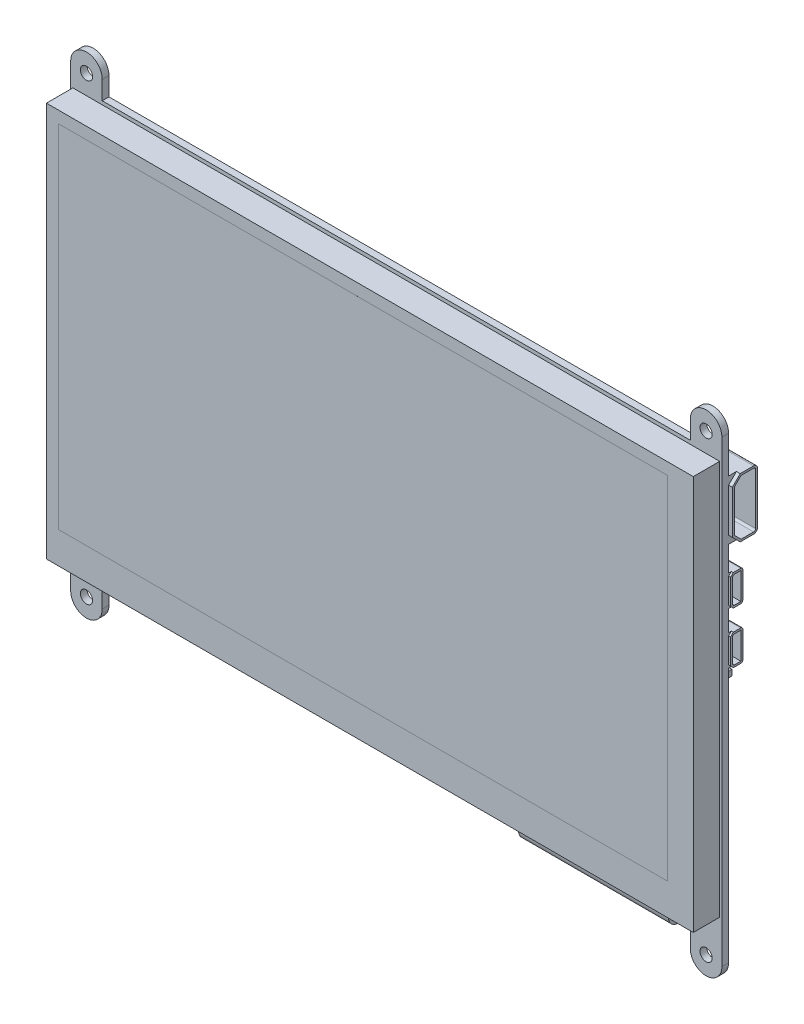
from build123d import *

# Parameters (mm, degrees)
SKICA1_W                             = 164
SKICA1_H                             = 100.1
P_IDAT_VYSUNUT_M1_DEPTH              = 6.7
SKICA1_3_W                           = 165.1
SKICA1_3_H                           = 106.9
P_IDAT_VYSUNUT_M2_DEPTH              = 1.7
SKICA2_R                             = 1.55
P_IDAT_VYSUNUT_M3_DEPTH              = 1.7
SKICA3_W                             = 154.5
SKICA3_H                             = 89.1
ODEBRAT_VYSUNUT_M1_DEPTH             = 1.5
SKICA3_2_W                           = 154.5
SKICA3_2_H                           = 89.1
P_IDAT_VYSUNUT_M4_DEPTH              = 1.5
SKICA4_W                             = 38
SKICA4_H                             = 2.75
P_IDAT_VYSUNUT_M5_DEPTH              = 6.3
ZAOBLIT1_R                           = 2.5
SKICA5_W                             = 28.5
SKICA5_H                             = 0.9
P_IDAT_VYSUNUT_M6_DEPTH              = 4.3
ZAOBLIT2_R                           = 3
SKICA6_W                             = 34
SKICA6_H                             = 22.4
P_IDAT_VYSUNUT_M7_DEPTH              = 2.4
SKICA6_3_W                           = 8.3
SKICA6_3_H                           = 16.4
P_IDAT_VYSUNUT_M8_DEPTH              = 1.8
SKICA6_4_W                           = 4.4
SKICA6_4_H                           = 11
P_IDAT_VYSUNUT_M9_DEPTH              = 1
SKICA6_5_W                           = 2.9
SKICA6_5_H                           = 17.2
SKICA6_5_W_2                         = 4.1
SKICA6_5_H_2                         = 4.3
P_IDAT_VYSUNUT_M10_DEPTH             = 1
SKICA6_6_W                           = 19.9
SKICA6_6_H                           = 13.8
P_IDAT_VYSUNUT_M11_DEPTH             = 1.45
SKICA6_7_W                           = 23.7
SKICA6_7_H                           = 12.8
SKICA6_7_W_2                         = 18.8
SKICA6_7_H_2                         = 17.8
P_IDAT_VYSUNUT_M12_DEPTH             = 0.8
ZKOSEN_1_SIZE                        = 0.8
SKICA7_W                             = 6.8
SKICA7_H                             = 6.8
P_IDAT_VYSUNUT_M13_DEPTH             = 1.5
SKICA7_3_W                           = 5.7
SKICA7_3_H                           = 10
SKICA7_3_W_2                         = 10
SKICA7_3_H_2                         = 5.7
P_IDAT_VYSUNUT_M14_DEPTH             = 0.8
P_IDAT_VYSUNUT_M15_DEPTH             = 0.7
P_IDAT_VYSUNUT_M16_DEPTH             = 4.2
SKICA7_6_W                           = 2.3
SKICA7_6_H                           = 7.8
SKICA7_6_W_2                         = 4.5
SKICA7_6_H_2                         = 2.5
SKICA7_6_W_3                         = 1.65
SKICA7_6_H_3                         = 5.9
SKICA7_6_W_4                         = 2
SKICA7_6_H_4                         = 1.3
P_IDAT_VYSUNUT_M17_DEPTH             = 0.8
ZKOSEN_2_SIZE                        = 0.8
SKICA8_W                             = 37.7
SKICA8_H                             = 5
ODEBRAT_VYSUNUT_M2_DEPTH             = 1.6
SKICA9_W                             = 25.6
SKICA9_H                             = 4
P_IDAT_VYSUNUT_M18_DEPTH             = 2
SKICA9_3_W                           = 2.35
SKICA9_3_H                           = 5
P_IDAT_VYSUNUT_M19_DEPTH             = 2.1
ZKOSEN_3_SIZE                        = 0.5
P_IDAT_VYSUNUT_M20_DEPTH             = 1.25
P_IDAT_VYSUNUT_M20_DEPTH_BACK        = 1.6
SKICA10_W                            = 25.6
SKICA10_H                            = 21
SKICA10_W_2                          = 2.9
SKICA10_H_2                          = 4.5
ZAOBLIT3_R                           = 3
SKICA11_W                            = 6.4
SKICA11_H                            = 3.4
P_IDAT_VYSUNUT_M21_DEPTH             = 1.9
SKICA11_3_W                          = 0.75
SKICA11_3_H                          = 2.1
SKICA11_3_W_2                        = 3
SKICA11_3_H_2                        = 2.5
P_IDAT_VYSUNUT_M23_DEPTH             = 0.8
ZKOSEN_4_SIZE                        = 0.8
SKICA12_W                            = 2.5
SKICA12_H                            = 7.5
SKICA12_H_2                          = 3.2
SKICA12_H_3                          = 4.5
SKICA12_H_4                          = 1
SKICA12_W_2                          = 11
SKICA12_H_5                          = 2.5
SKICA12_W_3                          = 2.8
SKICA12_W_4                          = 1
P_IDAT_VYSUNUT_M24_DEPTH             = 1.6
SKICA14_W                            = 2.4
SKICA14_H                            = 2.7
SKICA14_W_2                          = 4.4
P_IDAT_VYSUNUT_M25_DEPTH             = 0.8
P_IDAT_VYSUNUT_M26_DEPTH             = 1.6
SKICA15_W                            = 7.9
SKICA15_H                            = 2.8
SKICA15_W_2                          = 6.4
P_IDAT_VYSUNUT_M27_DEPTH             = 1.2
SKICA17_W                            = 5.2
SKICA17_H                            = 1.9
ODEBRAT_VYSUNUT_M3_DEPTH             = 1.6
SKICA18_W                            = 7.4
SKICA18_H                            = 5.5
P_IDAT_VYSUNUT_M28_DEPTH             = 2.4
SKICA18_3_W                          = 3.5
SKICA18_3_H                          = 13.3
P_IDAT_VYSUNUT_M29_DEPTH             = 0.5
P_IDAT_VYSUNUT_M29_DIRECTION_2_REACH = 107.189
ZAOBLIT4_R                           = 2
SKICA19_W                            = 11.7
SKICA19_H                            = 15
P_IDAT_VYSUNUT_M30_DEPTH             = 6.4
ZAOBLIT5_R                           = 1
ZKOSEN_5_SIZE                        = 2
ODEBRAT_VYSUNUT_M4_DEPTH             = 6.7
P_IDAT_START                         = -2.5
SKICA21_W                            = 1
SKICA21_H                            = 10
P_IDAT_VYSUNUT_M31_DEPTH             = 6.7
SKICA22_W                            = 5.8
SKICA22_H                            = 7.8
P_IDAT_VYSUNUT_M32_DEPTH             = 3.1
SKICA23_W                            = 2.1
SKICA23_H                            = 6.8
ODEBRAT_VYSUNUT_M5_DEPTH             = 3.9
ZAOBLIT6_R                           = 0.5
ZAOBLIT7_R                           = 0.5
ZKOSEN_6_SIZE                        = 0.7
SKICA24_W                            = 3.5
SKICA24_H                            = 9
P_IDAT_VYSUNUT_M33_DEPTH             = 3.25
SKICA24_3_W                          = 7.5
SKICA24_3_H                          = 1
P_IDAT_VYSUNUT_M34_DEPTH             = 1.4
ZKOSEN_7_SIZE                        = 1.4
SKICA25_W                            = 1.5
SKICA25_H                            = 1.5
P_IDAT_VYSUNUT_M35_DEPTH             = 2.1
SKICA25_3_W                          = 1.5
SKICA25_3_H                          = 2.2
ODEBRAT_VYSUNUT_M6_DEPTH             = 0.4
ZAOBLIT8_R                           = 1
ZAOBLIT9_R                           = 0.2


# Some blends are built 0.0001 mm under size
with BuildPart() as part:
    # Skica1 → Přidat vysunutím1 (new body)
    with BuildSketch(Plane.XY):
        Rectangle(SKICA1_W, SKICA1_H)
    extrude(amount=P_IDAT_VYSUNUT_M1_DEPTH)

    # Skica1<3> → Přidat vysunutím2 (add)
    with BuildSketch(Plane.XY):
        with Locations((0, -2.5)):
            Rectangle(SKICA1_3_W, SKICA1_3_H)
    extrude(amount=-P_IDAT_VYSUNUT_M2_DEPTH)

    # Skica2 → Přidat vysunutím3 (add)
    # profile 1 of 4: a face of its own
    with BuildSketch(Plane(origin=(0, 0, -1.7), x_dir=(-1, 0, 0), z_dir=(0, 0, -1))):
        with BuildLine():
            Line((-74.55, -55.95), (-82.55, -55.95))
            Line((-82.55, -55.95), (-82.55, -60.65))
            ThreePointArc((-82.55, -60.65), (-78.55, -64.65), (-74.55, -60.65))
            Line((-74.55, -60.65), (-74.55, -55.95))
        make_face()
        with Locations((-78.55, -60)):
            Circle(SKICA2_R, mode=Mode.SUBTRACT)
    # profile 2 of 4: a face of its own
    with BuildSketch(Plane(origin=(0, 0, -1.7), x_dir=(-1, 0, 0), z_dir=(0, 0, -1))):
        with BuildLine():
            Line((82.55, -55.95), (74.55, -55.95))
            Line((74.55, -55.95), (74.55, -60.65))
            ThreePointArc((74.55, -60.65), (78.55, -64.65), (82.55, -60.65))
            Line((82.55, -60.65), (82.55, -55.95))
        make_face()
        with Locations((78.55, -60)):
            Circle(SKICA2_R, mode=Mode.SUBTRACT)
    # profile 3 of 4: a face of its own
    with BuildSketch(Plane(origin=(0, 0, -1.7), x_dir=(-1, 0, 0), z_dir=(0, 0, -1))):
        with BuildLine():
            Line((74.55, 55.65), (74.55, 50.95))
            Line((74.55, 50.95), (82.55, 50.95))
            Line((82.55, 50.95), (82.55, 55.65))
            ThreePointArc((82.55, 55.65), (78.55, 59.65), (74.55, 55.65))
        make_face()
        with Locations((78.55, 55)):
            Circle(SKICA2_R, mode=Mode.SUBTRACT)
    # profile 4 of 4: a face of its own
    with BuildSketch(Plane(origin=(0, 0, -1.7), x_dir=(-1, 0, 0), z_dir=(0, 0, -1))):
        with BuildLine():
            Line((-82.55, 55.65), (-82.55, 50.95))
            Line((-82.55, 50.95), (-74.55, 50.95))
            Line((-74.55, 50.95), (-74.55, 55.65))
            ThreePointArc((-74.55, 55.65), (-78.55, 59.65), (-82.55, 55.65))
        make_face()
        with Locations((-78.55, 55)):
            Circle(SKICA2_R, mode=Mode.SUBTRACT)
    extrude(amount=-P_IDAT_VYSUNUT_M3_DEPTH)

    # Skica3 → Odebrat vysunutím1 (cut)
    with BuildSketch(Plane.XY.offset(6.7)):
        with Locations((-1.75, 2.5)):
            Rectangle(SKICA3_W, SKICA3_H)
    extrude(amount=-ODEBRAT_VYSUNUT_M1_DEPTH, mode=Mode.SUBTRACT)

    # Skica4 → Přidat vysunutím5 (add)
    with BuildSketch(Plane.XY):
        with Locations((56.3, -51.425)):
            Rectangle(SKICA4_W, SKICA4_H)
    extrude(amount=P_IDAT_VYSUNUT_M5_DEPTH)

    # Zaoblit1
    zaoblit1_edges = [part.edges().sort_by_distance(p)[0] for p in [
        (56.3, -52.8, 6.3),
    ]]
    fillet(zaoblit1_edges, radius=ZAOBLIT1_R)

    # Skica5 → Přidat vysunutím6 (add)
    with BuildSketch(Plane.XY):
        with Locations((-0.3, -50.5)):
            Rectangle(SKICA5_W, SKICA5_H)
    extrude(amount=P_IDAT_VYSUNUT_M6_DEPTH)

    # Zaoblit2
    # the kernel refuses this fillet: 3 mm, written as the material it takes off along each edge
    with BuildSketch(Plane(origin=(19.306071321, -50.95, 4.3), x_dir=(0, 0, -1), z_dir=(-1, 0, 0))) as zaoblit2_piece_1:
        with BuildLine():
            CenterArc((2.142428529, -3), ZAOBLIT2_R, 90, 45.572995999)
            Line((0, -0.9), (-0.042848571, -0.858))
            ThreePointArc((-0.042848571, -0.858), (-0.06, -0.45), (-0.06, 0))
            Line((-0.06, 0), (0, 0.06))
            Line((0, 0.06), (2.142428529, 0.06))
            Line((2.142428529, 0.06), (2.142428529, 0))
        make_face()
    extrude(amount=39.212142643, mode=Mode.SUBTRACT)

    # Skica6 → Přidat vysunutím7 (add)
    with BuildSketch(Plane(origin=(0, 0, -1.7), x_dir=(-1, 0, 0), z_dir=(0, 0, -1))):
        with Locations((49.45, 18.15)):
            Rectangle(SKICA6_W, SKICA6_H)
    extrude(amount=P_IDAT_VYSUNUT_M7_DEPTH)

    # Skica6<3> → Přidat vysunutím8 (add)
    with BuildSketch(Plane(origin=(0, 0, -1.7), x_dir=(-1, 0, 0), z_dir=(0, 0, -1))):
        with Locations((22.4, 15.05)):
            Rectangle(SKICA6_3_W, SKICA6_3_H)
    extrude(amount=P_IDAT_VYSUNUT_M8_DEPTH)

    # Skica6<4> → Přidat vysunutím9 (add)
    with BuildSketch(Plane(origin=(0, 0, -1.7), x_dir=(-1, 0, 0), z_dir=(0, 0, -1))):
        with Locations((16.05, 17.75)):
            Rectangle(SKICA6_4_W, SKICA6_4_H)
    extrude(amount=P_IDAT_VYSUNUT_M9_DEPTH)

    # Skica6<5> → Přidat vysunutím10 (add)
    with BuildSketch(Plane(origin=(0, 0, -1.7), x_dir=(-1, 0, 0), z_dir=(0, 0, -1))):
        with Locations((4.2, 21.45)):
            Rectangle(SKICA6_5_W, SKICA6_5_H)
        with Locations((7.7, 27.9)):
            Rectangle(SKICA6_5_W_2, SKICA6_5_H_2)
    extrude(amount=P_IDAT_VYSUNUT_M10_DEPTH)

    # Skica6<6> → Přidat vysunutím11 (add)
    with BuildSketch(Plane(origin=(0, 0, -1.7), x_dir=(-1, 0, 0), z_dir=(0, 0, -1))):
        with Locations((-11.7, 18.35)):
            Rectangle(SKICA6_6_W, SKICA6_6_H)
    extrude(amount=P_IDAT_VYSUNUT_M11_DEPTH)

    # Skica6<7> → Přidat vysunutím12 (add)
    with BuildSketch(Plane(origin=(0, 0, -1.7), x_dir=(-1, 0, 0), z_dir=(0, 0, -1))):
        with Locations((-11.7, 18.35)):
            Rectangle(SKICA6_7_W, SKICA6_7_H)
        with Locations((-11.7, 18.35)):
            Rectangle(SKICA6_7_W_2, SKICA6_7_H_2)
    extrude(amount=P_IDAT_VYSUNUT_M12_DEPTH)

    # Zkosení1
    zkosen_1_edges = [part.edges().sort_by_distance(p)[0] for p in [
        (11.7, 27.25, -2.5),
        (23.55, 18.35, -2.5),
        (-0.15, 18.35, -2.5),
        (11.7, 9.45, -2.5),
    ]]
    chamfer(zkosen_1_edges, length=ZKOSEN_1_SIZE - 0.0001)  # a hair under: the kernel refuses the full size

    # Skica7 → Přidat vysunutím13 (add)
    with BuildSketch(Plane(origin=(0, 0, -1.7), x_dir=(-1, 0, 0), z_dir=(0, 0, -1))):
        with Locations((-32.05, -29.25)):
            Rectangle(SKICA7_W, SKICA7_H)
    extrude(amount=P_IDAT_VYSUNUT_M13_DEPTH)

    # Skica7<3> → Přidat vysunutím14 (add)
    with BuildSketch(Plane(origin=(0, 0, -1.7), x_dir=(-1, 0, 0), z_dir=(0, 0, -1))):
        with Locations((-32.05, -29.25)):
            Rectangle(SKICA7_3_W, SKICA7_3_H)
        with Locations((-32.05, -29.25)):
            Rectangle(SKICA7_3_W_2, SKICA7_3_H_2)
    extrude(amount=P_IDAT_VYSUNUT_M14_DEPTH)

    # Skica7<4> → Přidat vysunutím15 (add)
    with BuildSketch(Plane(origin=(0, 0, -1.7), x_dir=(-1, 0, 0), z_dir=(0, 0, -1))):
        with BuildLine():
            Line((-48.15, -31), (-48.15, -24.6))
            ThreePointArc((-48.15, -24.6), (-45.9, -22.35), (-43.65, -24.6))
            Line((-43.65, -24.6), (-43.65, -31))
            ThreePointArc((-43.65, -31), (-45.9, -33.25), (-48.15, -31))
        make_face()
    extrude(amount=P_IDAT_VYSUNUT_M15_DEPTH)

    # Skica7<5> → Přidat vysunutím16 (add)
    with BuildSketch(Plane(origin=(0, 0, -1.7), x_dir=(-1, 0, 0), z_dir=(0, 0, -1))):
        with BuildLine():
            Line((-44.15, -24.6), (-44.15, -31))
            ThreePointArc((-44.15, -31), (-45.9, -32.75), (-47.65, -31))
            Line((-47.65, -31), (-47.65, -24.6))
            ThreePointArc((-47.65, -24.6), (-45.9, -22.85), (-44.15, -24.6))
        make_face()
    extrude(amount=P_IDAT_VYSUNUT_M16_DEPTH)

    # Skica7<6> → Přidat vysunutím17 (add)
    with BuildSketch(Plane(origin=(0, 0, -1.7), x_dir=(-1, 0, 0), z_dir=(0, 0, -1))):
        with Locations((-23, -28.55)):
            Rectangle(SKICA7_6_W, SKICA7_6_H)
        with Locations((-31.8, -20.6)):
            Rectangle(SKICA7_6_W_2, SKICA7_6_H_2)
        Polygon((-42.15, -24.85), (-42.15, -35.15), (-40.5, -35.15), (-40.5, -29.25), (-40.5, -24.85), align=None)
        with Locations((-39.675, -32.2)):
            Rectangle(SKICA7_6_W_3, SKICA7_6_H_3)
        with Locations((-28.55, -36.8)):
            Rectangle(SKICA7_6_W_4, SKICA7_6_H_4)
    extrude(amount=P_IDAT_VYSUNUT_M17_DEPTH)

    # Zkosení2
    zkosen_2_edges = [part.edges().sort_by_distance(p)[0] for p in [
        (32.05, -24.25, -2.5),
        (37.05, -29.25, -2.5),
        (27.05, -29.25, -2.5),
        (32.05, -34.25, -2.5),
    ]]
    chamfer(zkosen_2_edges, length=ZKOSEN_2_SIZE - 0.0001)  # a hair under: the kernel refuses the full size

    # Skica8 → Odebrat vysunutím2 (cut)
    with BuildSketch(Plane(origin=(0, 0, -1.7), x_dir=(-1, 0, 0), z_dir=(0, 0, -1))):
        with Locations((1.7, -33.95)):
            Rectangle(SKICA8_W, SKICA8_H)
    extrude(amount=-ODEBRAT_VYSUNUT_M2_DEPTH, mode=Mode.SUBTRACT)

    # Skica9 → Přidat vysunutím18 (add)
    with BuildSketch(Plane(origin=(0, 0, -1.7), x_dir=(-1, 0, 0), z_dir=(0, 0, -1))):
        with Locations((1.1, -10.85)):
            Rectangle(SKICA9_W, SKICA9_H)
    extrude(amount=P_IDAT_VYSUNUT_M18_DEPTH)

    # Skica9<3> → Přidat vysunutím19 (add)
    with BuildSketch(Plane(origin=(0, 0, -1.7), x_dir=(-1, 0, 0), z_dir=(0, 0, -1))):
        with Locations((-12.875, -10.85)):
            Rectangle(SKICA9_3_W, SKICA9_3_H)
        with Locations((15.075, -10.85)):
            Rectangle(SKICA9_3_W, SKICA9_3_H)
    extrude(amount=P_IDAT_VYSUNUT_M19_DEPTH)

    # Zkosení3
    zkosen_3_edges = [part.edges().sort_by_distance(p)[0] for p in [
        (-1.1, -8.85, -1.7),
    ]]
    chamfer(zkosen_3_edges, length=ZKOSEN_3_SIZE)

    # Skica10 → Přidat vysunutím20 (add, two sides: drawn at the far end of the back side and taken through both)
    with BuildSketch(Plane(origin=(0, 0, -1.7), x_dir=(-1, 0, 0), z_dir=(0, 0, -1)).offset(-P_IDAT_VYSUNUT_M20_DEPTH_BACK)):
        with Locations((1.1, -23.35)):
            Rectangle(SKICA10_W, SKICA10_H)
        with Locations((-13.15, -31.6)):
            Rectangle(SKICA10_W_2, SKICA10_H_2)
        Polygon((-11.7, -29.35), (-11.7, -24.85), (-14.6, -29.35), align=None)
    extrude(amount=P_IDAT_VYSUNUT_M20_DEPTH + P_IDAT_VYSUNUT_M20_DEPTH_BACK)

    # Zaoblit3
    # the kernel refuses this fillet: 3 mm, written as the material it takes off along each edge
    with BuildSketch(Plane(origin=(-21.390619133, -33.85, -2.95), x_dir=(0, 0, 1), z_dir=(1, 0, 0))) as zaoblit3_piece_1_section:
        with BuildLine():
            CenterArc((3, -2.996247653), ZAOBLIT3_R, 92.865983983, 87.134016017)
            Line((0, -2.996247653), (0, 0))
            Line((0, 0), (2.85, 0))
        make_face()
    zaoblit3_piece_1 = extrude(amount=35.990619133, mode=Mode.PRIVATE)
    zaoblit3_piece_1 = split(zaoblit3_piece_1, bisect_by=Plane(origin=(-20.55, -33.85, -2.95), z_dir=(1, 0, 0)), keep=Keep.TOP, mode=Mode.PRIVATE)
    add(zaoblit3_piece_1, mode=Mode.SUBTRACT)

    # Skica11 → Přidat vysunutím21 (add)
    with BuildSketch(Plane(origin=(0, 0, -1.7), x_dir=(-1, 0, 0), z_dir=(0, 0, -1))):
        with Locations((-36.95, -7.85)):
            Rectangle(SKICA11_W, SKICA11_H)
        with Locations((-36.95, 4.15)):
            Rectangle(SKICA11_W, SKICA11_H)
    extrude(amount=P_IDAT_VYSUNUT_M21_DEPTH)

    # Skica11<3> → Přidat vysunutím23 (add)
    with BuildSketch(Plane(origin=(0, 0, -1.7), x_dir=(-1, 0, 0), z_dir=(0, 0, -1))):
        with Locations((-34.7, -10.6)):
            Rectangle(SKICA11_3_W, SKICA11_3_H)
        with Locations((-36.95, 7.1)):
            Rectangle(SKICA11_3_W_2, SKICA11_3_H_2)
        with Locations((-39.2, 1.4)):
            Rectangle(SKICA11_3_W, SKICA11_3_H)
        with Locations((-36.95, 1.4)):
            Rectangle(SKICA11_3_W, SKICA11_3_H)
        with Locations((-34.7, 1.4)):
            Rectangle(SKICA11_3_W, SKICA11_3_H)
        with Locations((-36.95, -4.9)):
            Rectangle(SKICA11_3_W_2, SKICA11_3_H_2)
        with Locations((-39.2, -10.6)):
            Rectangle(SKICA11_3_W, SKICA11_3_H)
        with Locations((-36.95, -10.6)):
            Rectangle(SKICA11_3_W, SKICA11_3_H)
    extrude(amount=P_IDAT_VYSUNUT_M23_DEPTH)

    # Zkosení4
    zkosen_4_edges = [part.edges().sort_by_distance(p)[0] for p in [
        (39.2, 0.35, -2.5),
        (34.7, 0.35, -2.5),
        (36.95, 0.35, -2.5),
        (36.95, 8.35, -2.5),
        (36.95, -3.65, -2.5),
        (34.7, -11.65, -2.5),
        (36.95, -11.65, -2.5),
        (39.2, -11.65, -2.5),
    ]]
    chamfer(zkosen_4_edges, length=ZKOSEN_4_SIZE - 0.0001)  # a hair under: the kernel refuses the full size

    # Skica12 → Přidat vysunutím24 (add)
    with BuildSketch(Plane(origin=(0, 0, -1.7), x_dir=(-1, 0, 0), z_dir=(0, 0, -1))):
        with Locations((-29.1, -7.9)):
            Rectangle(SKICA12_W, SKICA12_H)
        with Locations((-29.1, 3.35)):
            Rectangle(SKICA12_W, SKICA12_H_2)
        with Locations((-29.1, 12.4)):
            Rectangle(SKICA12_W, SKICA12_H_3)
        with Locations((-29.1, 19.15)):
            Rectangle(SKICA12_W, SKICA12_H_4)
        with Locations((-11.05, -1.5)):
            Rectangle(SKICA12_W_2, SKICA12_H_5)
        with Locations((-12.85, 31.5)):
            Rectangle(SKICA12_W_3, SKICA12_H_5)
        with Locations((-0.55, 31.5)):
            Rectangle(SKICA12_W_3, SKICA12_H_5)
        with Locations((-18.15, 5.3)):
            Rectangle(SKICA12_W_4, SKICA12_H_5)
        with Locations((-11.65, 5.3)):
            Rectangle(SKICA12_W_4, SKICA12_H_5)
    extrude(amount=P_IDAT_VYSUNUT_M24_DEPTH)

    # Skica14 → Přidat vysunutím25 (add)
    with BuildSketch(Plane(origin=(0, 0, -1.7), x_dir=(-1, 0, 0), z_dir=(0, 0, -1))):
        with Locations((9.75, -1.4)):
            Rectangle(SKICA14_W, SKICA14_H)
        with Locations((14.55, -1.4)):
            Rectangle(SKICA14_W_2, SKICA14_H)
    extrude(amount=P_IDAT_VYSUNUT_M25_DEPTH)

    # Skica14<3> → Přidat vysunutím26 (add)
    with BuildSketch(Plane(origin=(0, 0, -1.7), x_dir=(-1, 0, 0), z_dir=(0, 0, -1))):
        Polygon((10.95, -0.05), (10.95, -2.75), (12.35, -2.75), (12.35, -0.05), (12.35, 1.25), (10.95, 1.25), align=None)
    extrude(amount=P_IDAT_VYSUNUT_M26_DEPTH)

    # Skica15 → Přidat vysunutím27 (add)
    with BuildSketch(Plane(origin=(0, 0, -1.7), x_dir=(-1, 0, 0), z_dir=(0, 0, -1))):
        with Locations((-63.3, 43.55)):
            Rectangle(SKICA15_W, SKICA15_H)
        with Locations((-63.55, 38.75)):
            Rectangle(SKICA15_W_2, SKICA15_H)
    extrude(amount=P_IDAT_VYSUNUT_M27_DEPTH)

    # Skica17 → Odebrat vysunutím3 (cut)
    with BuildSketch(Plane(origin=(0, 0, -1.7), x_dir=(-1, 0, 0), z_dir=(0, 0, -1))):
        with Locations((-57.45, 8.5)):
            Rectangle(SKICA17_W, SKICA17_H)
    extrude(amount=-ODEBRAT_VYSUNUT_M3_DEPTH, mode=Mode.SUBTRACT)

    # Skica18 → Přidat vysunutím28 (add)
    with BuildSketch(Plane(origin=(0, 0, -1.7), x_dir=(-1, 0, 0), z_dir=(0, 0, -1))):
        with Locations((-57.75, 24.1)):
            Rectangle(SKICA18_W, SKICA18_H)
    extrude(amount=P_IDAT_VYSUNUT_M28_DEPTH)

    # Skica18<3> → Přidat vysunutím29 (add)
    with BuildSketch(Plane(origin=(0, 0, -1.7), x_dir=(-1, 0, 0), z_dir=(0, 0, -1))):
        with Locations((-57.75, 14.7)):
            Rectangle(SKICA18_3_W, SKICA18_3_H)
    extrude(amount=P_IDAT_VYSUNUT_M29_DEPTH)

    # Přidat vysunutím29 direction 2: up to this face of the body (flat: up to its plane)
    p_idat_vysunut_m29_direction_2_end = Plane(part.part.faces().sort_by_distance((57.45, 8.5, -0.1))[0])
    # Skica18<3> → Přidat vysunutím29 direction 2 (add, up to the picked face)
    with BuildSketch(Plane(origin=(0, 0, -1.7), x_dir=(-1, 0, 0), z_dir=(0, 0, -1)), mode=Mode.PRIVATE) as p_idat_vysunut_m29_direction_2_sk1:
        with Locations((-57.75, 14.7)):
            Rectangle(SKICA18_3_W, SKICA18_3_H)
    p_idat_vysunut_m29_direction_2_tool1 = split(extrude(p_idat_vysunut_m29_direction_2_sk1.sketch, amount=-P_IDAT_VYSUNUT_M29_DIRECTION_2_REACH, mode=Mode.PRIVATE), bisect_by=p_idat_vysunut_m29_direction_2_end, keep=Keep.BOTH, mode=Mode.PRIVATE)
    add(p_idat_vysunut_m29_direction_2_tool1.solids().sort_by(Axis((57.75, 14.7, -1.7), (0, 0, 1)))[0])

    # Zaoblit4
    zaoblit4_edges = [part.edges().sort_by_distance(p)[0] for p in [
        (57.75, 8.05, -2.2),
    ]]
    fillet(zaoblit4_edges, radius=ZAOBLIT4_R)

    # Skica19 → Přidat vysunutím30 (add)
    with BuildSketch(Plane(origin=(0, 0, -1.7), x_dir=(-1, 0, 0), z_dir=(0, 0, -1))):
        with Locations((-77.65, 38.75)):
            Rectangle(SKICA19_W, SKICA19_H)
    extrude(amount=P_IDAT_VYSUNUT_M30_DEPTH)

    # Zaoblit5
    zaoblit5_edges = [part.edges().sort_by_distance(p)[0] for p in [
        (77.65, 46.25, -8.1),
        (77.65, 31.25, -8.1),
    ]]
    fillet(zaoblit5_edges, radius=ZAOBLIT5_R)

    # Zkosení5
    zkosen_5_edges = [part.edges().sort_by_distance(p)[0] for p in [
        (83.025, 46.25, -1.7),
        (83.025, 31.25, -1.7),
    ]]
    chamfer(zkosen_5_edges, length=ZKOSEN_5_SIZE)

    # Skica20 → Odebrat vysunutím4 (cut)
    with BuildSketch(Plane(origin=(83.5, 0, 0), x_dir=(0, 0, -1), z_dir=(1, 0, 0))):
        with BuildLine():
            Line((7.6, 32.25), (7.6, 45.25))
            ThreePointArc((7.6, 45.25), (7.453553391, 45.603553391), (7.1, 45.75))
            Line((7.1, 45.75), (3.907106781, 45.75))
            Line((3.907106781, 45.75), (2.2, 44.042893219))
            Line((2.2, 44.042893219), (2.2, 33.457106781))
            Line((2.2, 33.457106781), (3.907106781, 31.75))
            Line((3.907106781, 31.75), (7.1, 31.75))
            ThreePointArc((7.1, 31.75), (7.453553391, 31.896446609), (7.6, 32.25))
        make_face()
    extrude(amount=-ODEBRAT_VYSUNUT_M4_DEPTH, mode=Mode.SUBTRACT)

    # Skica21 → Přidat vysunutím31 (add)
    with BuildSketch(Plane(origin=(76.8, 0, 0), x_dir=(0, 0, -1), z_dir=(1, 0, 0)).offset(P_IDAT_START)):
        with Locations((4.3, 38.75)):
            Rectangle(SKICA21_W, SKICA21_H)
    extrude(amount=P_IDAT_VYSUNUT_M31_DEPTH)

    # Skica22 → Přidat vysunutím32 (add)
    with BuildSketch(Plane(origin=(0, 0, -1.7), x_dir=(-1, 0, 0), z_dir=(0, 0, -1))):
        with Locations((-80.15, 21.05)):
            Rectangle(SKICA22_W, SKICA22_H)
        with Locations((-80.15, 7.95)):
            Rectangle(SKICA22_W, SKICA22_H)
    extrude(amount=P_IDAT_VYSUNUT_M32_DEPTH)

    # Skica23 → Odebrat vysunutím5 (cut)
    with BuildSketch(Plane(origin=(83.05, 0, 0), x_dir=(0, 0, -1), z_dir=(1, 0, 0))):
        with Locations((3.25, 7.95)):
            Rectangle(SKICA23_W, SKICA23_H)
        with Locations((3.25, 21.05)):
            Rectangle(SKICA23_W, SKICA23_H)
    extrude(amount=-ODEBRAT_VYSUNUT_M5_DEPTH, mode=Mode.SUBTRACT)

    # Zaoblit6
    zaoblit6_edges = [part.edges().sort_by_distance(p)[0] for p in [
        (80.15, 17.15, -4.8),
        (80.15, 24.95, -4.8),
        (80.15, 4.05, -4.8),
        (80.15, 11.85, -4.8),
    ]]
    fillet(zaoblit6_edges, radius=ZAOBLIT6_R)

    # Zaoblit7
    zaoblit7_edges = [part.edges().sort_by_distance(p)[0] for p in [
        (81.1, 4.55, -2.2),
        (81.1, 11.35, -2.2),
        (81.1, 17.65, -2.2),
        (81.1, 24.45, -2.2),
    ]]
    fillet(zaoblit7_edges, radius=ZAOBLIT7_R)

    # Zkosení6
    zkosen_6_edges = [part.edges().sort_by_distance(p)[0] for p in [
        (82.8, 17.15, -1.7),
        (82.8, 24.95, -1.7),
        (82.8, 4.05, -1.7),
        (82.8, 11.85, -1.7),
    ]]
    chamfer(zkosen_6_edges, length=ZKOSEN_6_SIZE)

    # Skica24 → Přidat vysunutím33 (add)
    with BuildSketch(Plane(origin=(0, 0, -1.7), x_dir=(-1, 0, 0), z_dir=(0, 0, -1))):
        with Locations((-77.3, -2.95)):
            Rectangle(SKICA24_W, SKICA24_H)
    extrude(amount=P_IDAT_VYSUNUT_M33_DEPTH)

    # Skica24<3> → Přidat vysunutím34 (add)
    with BuildSketch(Plane(origin=(0, 0, -1.7), x_dir=(-1, 0, 0), z_dir=(0, 0, -1))):
        with Locations((-77.3, -2.95)):
            Rectangle(SKICA24_3_W, SKICA24_3_H)
        with Locations((-77.3, -0.45)):
            Rectangle(SKICA24_3_W, SKICA24_3_H)
        with Locations((-77.3, -5.45)):
            Rectangle(SKICA24_3_W, SKICA24_3_H)
    extrude(amount=P_IDAT_VYSUNUT_M34_DEPTH)

    # Zkosení7
    zkosen_7_edges = [part.edges().sort_by_distance(p)[0] for p in [
        (73.55, -0.45, -3.1),
        (73.55, -2.95, -3.1),
        (73.55, -5.45, -3.1),
        (81.05, -5.45, -3.1),
        (81.05, -2.95, -3.1),
        (81.05, -0.45, -3.1),
    ]]
    chamfer(zkosen_7_edges, length=ZKOSEN_7_SIZE - 0.0001)  # a hair under: the kernel refuses the full size

    # Skica25 → Přidat vysunutím35 (add)
    with BuildSketch(Plane(origin=(0, 0, -4.95), x_dir=(-1, 0, 0), z_dir=(0, 0, -1))):
        with Locations((-77.3, -1.85)):
            Rectangle(SKICA25_W, SKICA25_H)
    extrude(amount=P_IDAT_VYSUNUT_M35_DEPTH)

    # Skica25<3> → Odebrat vysunutím6 (cut)
    with BuildSketch(Plane(origin=(0, 0, -4.95), x_dir=(-1, 0, 0), z_dir=(0, 0, -1))):
        with Locations((-77.3, -3.7)):
            Rectangle(SKICA25_3_W, SKICA25_3_H)
    extrude(amount=-ODEBRAT_VYSUNUT_M6_DEPTH, mode=Mode.SUBTRACT)

    # Zaoblit8
    zaoblit8_edges = [part.edges().sort_by_distance(p)[0] for p in [
        (11.7, -24.85, -2.325),
        (14.6, -29.35, -2.325),
    ]]
    fillet(zaoblit8_edges, radius=ZAOBLIT8_R)

    # Zaoblit9
    zaoblit9_edges = [part.edges().sort_by_distance(p)[0] for p in [
        (48.15, -27.8, -2.4),
        (45.9, -33.25, -2.4),
        (43.65, -27.8, -2.4),
        (45.9, -22.35, -2.4),
        (44.15, -27.8, -5.9),
        (45.9, -22.85, -5.9),
        (47.65, -27.8, -5.9),
        (45.9, -32.75, -5.9),
    ]]
    fillet(zaoblit9_edges, radius=ZAOBLIT9_R)


with BuildPart() as body_2:
    # Skica3<2> → Přidat vysunutím4 (new body)
    with BuildSketch(Plane.XY.offset(6.7)):
        with Locations((-1.75, 2.5)):
            Rectangle(SKICA3_2_W, SKICA3_2_H)
    extrude(amount=-P_IDAT_VYSUNUT_M4_DEPTH)


solid = Compound([part.part, body_2.part])
